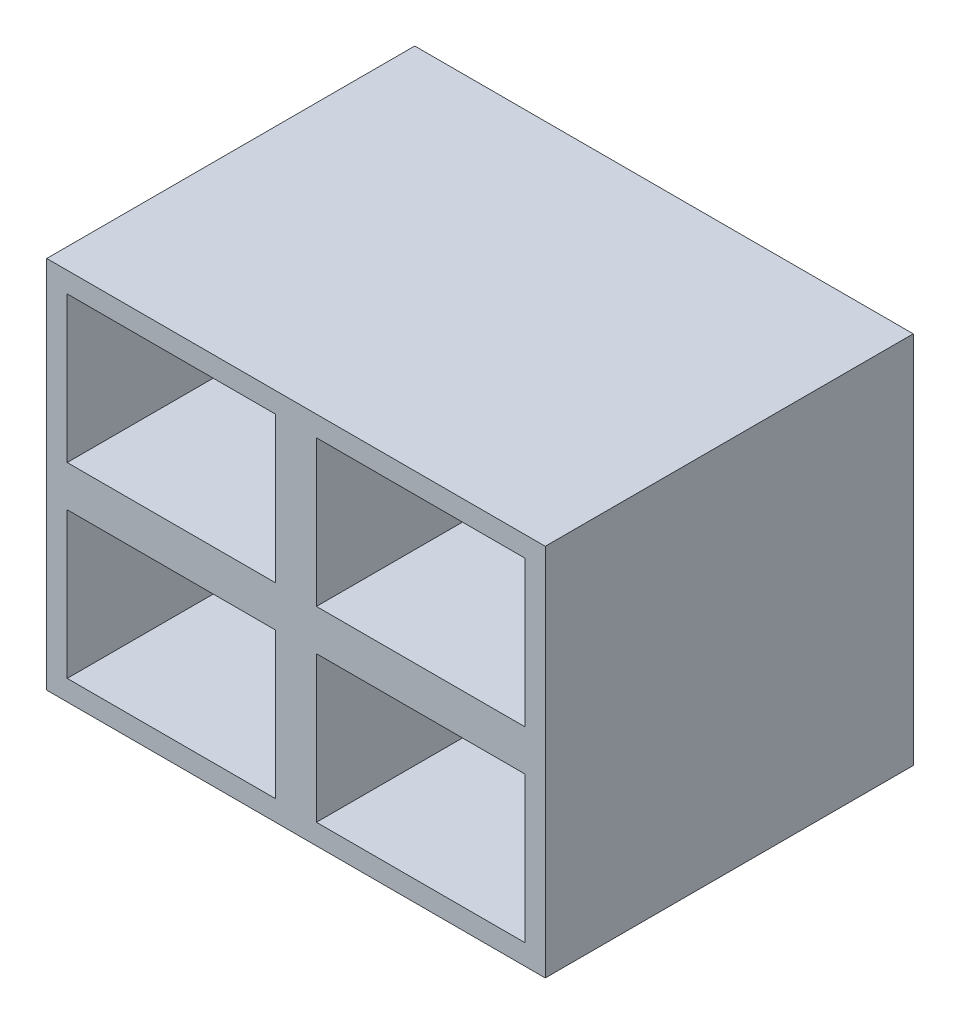
from build123d import *

# Parameters (mm, degrees)
SKETCH1_W           = 1219.2
SKETCH1_H           = 914.4
BOSS_EXTRUDE1_DEPTH = 900
SKETCH2_W           = 509.6
SKETCH2_H           = 357.2
CUT_EXTRUDE1_DEPTH  = 900


with BuildPart() as part:
    # Sketch1 → Boss-Extrude1 (new body)
    with BuildSketch(Plane.XY):
        Rectangle(SKETCH1_W, SKETCH1_H)
    extrude(amount=BOSS_EXTRUDE1_DEPTH)

    # Sketch2 → Cut-Extrude1 (cut)
    with BuildSketch(Plane.XY.offset(900)):
        with Locations((304.8, 228.6)):
            Rectangle(SKETCH2_W, SKETCH2_H)
        with Locations((-304.8, 228.6)):
            Rectangle(SKETCH2_W, SKETCH2_H)
        with Locations((304.8, -228.6)):
            Rectangle(SKETCH2_W, SKETCH2_H)
        with Locations((-304.8, -228.6)):
            Rectangle(SKETCH2_W, SKETCH2_H)
    extrude(amount=-CUT_EXTRUDE1_DEPTH, mode=Mode.SUBTRACT)


solid = part.part
